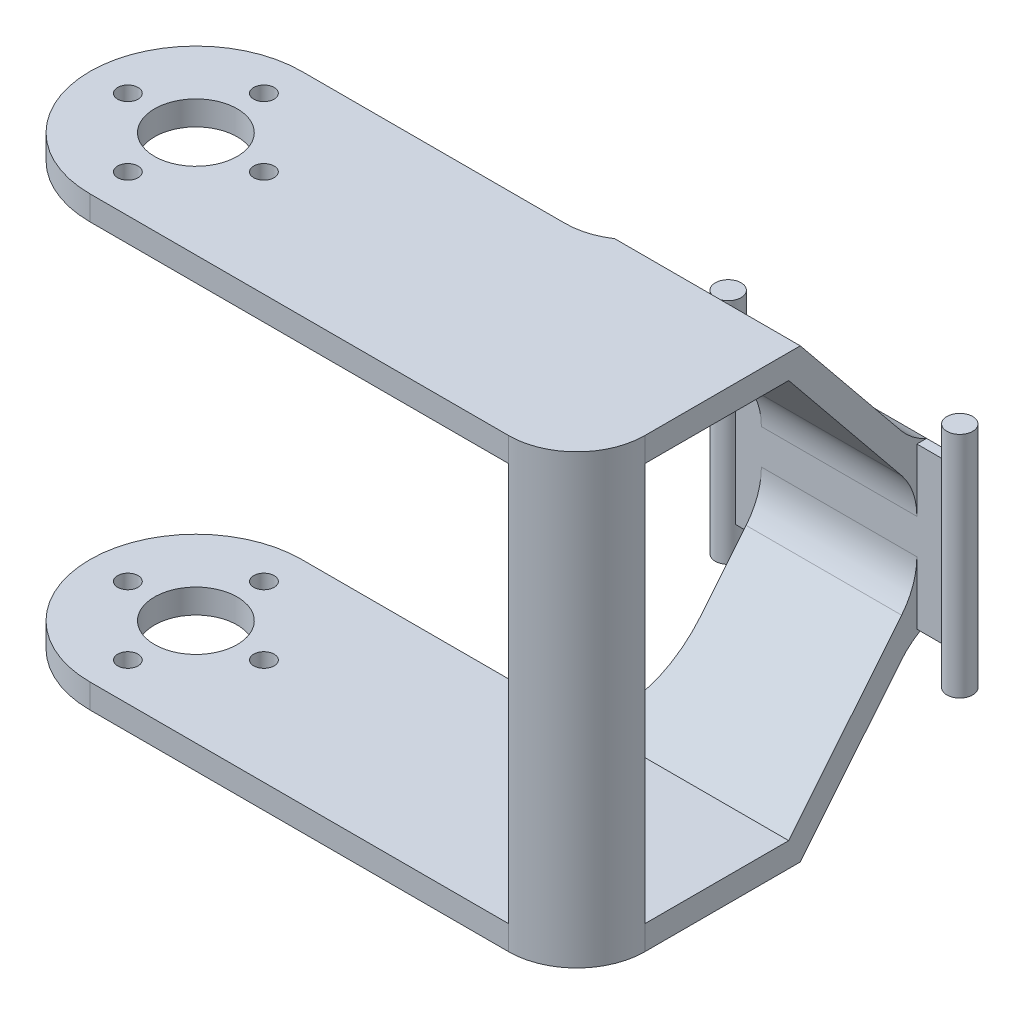
from build123d import *

# Parameters (mm, degrees)
SKETCH1_W           = 23.83
SKETCH1_H           = 1
BOSS_EXTRUDE1_DEPTH = 16.5
SKETCH2_R           = 1.325
BOSS_EXTRUDE2_DEPTH = 11.75
BOSS_EXTRUDE4_DEPTH = 8
SKETCH5_W           = 21.811051378
SKETCH5_H           = 2.5
BOSS_EXTRUDE5_DEPTH = 45
SKETCH6_R           = 4.25
SKETCH6_R_2         = 1.05
CUT_EXTRUDE1_DEPTH  = 79.646360374
FILLET1_R           = 7
FILLET2_R           = 7
FILLET3_R           = 7
BOSS_EXTRUDE6_START = 41
BOSS_EXTRUDE6_DEPTH = 41


with BuildPart() as part:
    # Sketch1 → Boss-Extrude1 (new body)
    with BuildSketch(Plane(origin=(0, 0, 0), x_dir=(1, 0, 0), z_dir=(0, 1, 0))):
        Rectangle(SKETCH1_W, SKETCH1_H)
    extrude(amount=BOSS_EXTRUDE1_DEPTH)

    # Sketch2 → Boss-Extrude2 (add, symmetric)
    with BuildSketch(Plane(origin=(0, 8.25, 0), x_dir=(1, 0, 0), z_dir=(0, 1, 0))):
        with Locations(Location((-11.915, 0, 0), (0, 0, 270))):
            Circle(SKETCH2_R)
        with Locations(Location((11.915, 0, 0), (0, 0, 270))):
            Circle(SKETCH2_R)
    extrude(amount=BOSS_EXTRUDE2_DEPTH, both=True)

    # Sketch4 → Boss-Extrude4 (add, symmetric)
    with BuildSketch(Plane(origin=(0, 0, 0), x_dir=(0, 0, -1), z_dir=(1, 0, 0))):
        Polygon((-0.5, 12.538583985), (-0.5, 16.5), (-12.5, 31.25), (-35.5, 31.25), (-35.5, 28.75), (-13.688948622, 28.75), align=None)
        Polygon((-0.5, 0), (-0.5, 3.961416015), (-13.688948622, -12.25), (-35.5, -12.25), (-35.5, -14.75), (-12.5, -14.75), align=None)
    extrude(amount=BOSS_EXTRUDE4_DEPTH, both=True)

    # Sketch5 → Boss-Extrude5 (add)
    with BuildSketch(Plane.ZY.offset(8)):
        with Locations((24.594474311, 30)):
            Rectangle(SKETCH5_W, SKETCH5_H)
        with Locations((24.594474311, -13.5)):
            Rectangle(SKETCH5_W, SKETCH5_H)
    extrude(amount=BOSS_EXTRUDE5_DEPTH)

    # Sketch6 → Cut-Extrude1 (cut, through all)
    with BuildSketch(Plane(origin=(0, 31.25, 0), x_dir=(1, 0, 0), z_dir=(0, 1, 0))):
        with Locations(Location((-42.094474311, -24.594474311, 0), (0, 0, 270))):
            Circle(SKETCH6_R)
        with Locations(Location((-49.094474311, -24.594474311, 0), (0, 0, 270))):
            Circle(SKETCH6_R_2)
        with Locations(Location((-42.094474311, -17.594474311, 0), (0, 0, 270))):
            Circle(SKETCH6_R_2)
        with Locations(Location((-35.094474311, -24.594474311, 0), (0, 0, 270))):
            Circle(SKETCH6_R_2)
        with Locations(Location((-42.094474311, -31.594474311, 0), (0, 0, 270))):
            Circle(SKETCH6_R_2)
        with BuildLine():
            ThreePointArc((-53, -24.594474311), (-49.805845478, -16.883103144), (-42.094474311, -13.688948622))
            Line((-42.094474311, -13.688948622), (-53, -13.688948622))
            Line((-53, -13.688948622), (-53, -24.594474311))
        make_face()
        with BuildLine():
            ThreePointArc((-42.094474311, -35.5), (-49.805845478, -32.305845478), (-53, -24.594474311))
            Line((-53, -24.594474311), (-53, -35.5))
            Line((-53, -35.5), (-42.094474311, -35.5))
        make_face()
    extrude(amount=-CUT_EXTRUDE1_DEPTH, mode=Mode.SUBTRACT)

    # Fillet1
    # the kernel refuses this fillet: 7 mm, written as the material it adds along each edge
    with BuildSketch(Plane(origin=(-8, -14.75, 13.688948622), x_dir=(-1, 0, 0), z_dir=(0, 1, 0))) as fillet1_piece_1_section:
        with BuildLine():
            CenterArc((FILLET1_R, -FILLET1_R), FILLET1_R, 90, 90)
            Line((0, -FILLET1_R), (0, 0))
            Line((0, 0), (FILLET1_R, 0))
        make_face()
    fillet1_piece_1 = extrude(amount=2.5, mode=Mode.PRIVATE)
    fillet1_piece_1 = split(fillet1_piece_1, bisect_by=Plane(origin=(-10.031790315, -14.125351158, 11.991811112), z_dir=(0, 0.6310874674162202, 0.7757116786991036)), keep=Keep.TOP, mode=Mode.PRIVATE)
    fillet1_piece_1 = split(fillet1_piece_1, bisect_by=Plane(origin=(-10.031790315, -12.54763249, 13.931090308), z_dir=(0, -0.6310874674162201, -0.7757116786991036)), keep=Keep.TOP, mode=Mode.PRIVATE)
    add(fillet1_piece_1)
    with BuildSketch(Plane(origin=(-8, -14.75, 13.688948622), x_dir=(-1, 0, 0), z_dir=(0, 1, 0))) as fillet1_piece_2_section:
        with BuildLine():
            CenterArc((FILLET1_R, -FILLET1_R), FILLET1_R, 90, 90)
            Line((0, -FILLET1_R), (0, 0))
            Line((0, 0), (FILLET1_R, 0))
        make_face()
    fillet1_piece_2 = extrude(amount=20, mode=Mode.PRIVATE)
    fillet1_piece_2 = split(fillet1_piece_2, bisect_by=Plane(origin=(-8.829123945, -11.325395044, 9.713880714), z_dir=(0, 0.6310874674162202, 0.7757116786991036)), keep=Keep.TOP, mode=Mode.PRIVATE)
    fillet1_piece_2 = split(fillet1_piece_2, bisect_by=Plane(origin=(-8.829123945, -12.25, 10.954048459), z_dir=(0, 1, 0)), keep=Keep.TOP, mode=Mode.PRIVATE)
    fillet1_piece_2 = split(fillet1_piece_2, bisect_by=Plane(origin=(-8.829123945, -9.747676376, 11.653159911), z_dir=(0, -0.6310874674162201, -0.7757116786991036)), keep=Keep.TOP, mode=Mode.PRIVATE)
    add(fillet1_piece_2)
    with BuildSketch(Plane(origin=(-8, 31.25, 13.688948622), x_dir=(0, 0, -1), z_dir=(0, -1, 0))) as fillet1_piece_3_section:
        with BuildLine():
            CenterArc((FILLET1_R, -FILLET1_R), FILLET1_R, 90, 90)
            Line((0, -FILLET1_R), (0, 0))
            Line((0, 0), (FILLET1_R, 0))
        make_face()
    fillet1_piece_3 = extrude(amount=2.5, mode=Mode.PRIVATE)
    fillet1_piece_3 = split(fillet1_piece_3, bisect_by=Plane(origin=(-10.031790315, 29.047632489, 13.931090308), z_dir=(0, 0.6310874674162203, -0.7757116786991034)), keep=Keep.TOP, mode=Mode.PRIVATE)
    fillet1_piece_3 = split(fillet1_piece_3, bisect_by=Plane(origin=(-10.031790315, 30.625351158, 11.991811112), z_dir=(0, -0.6310874674162202, 0.7757116786991036)), keep=Keep.TOP, mode=Mode.PRIVATE)
    add(fillet1_piece_3)
    with BuildSketch(Plane(origin=(-8, 31.25, 13.688948622), x_dir=(0, 0, -1), z_dir=(0, -1, 0))) as fillet1_piece_4_section:
        with BuildLine():
            CenterArc((FILLET1_R, -FILLET1_R), FILLET1_R, 90, 90)
            Line((0, -FILLET1_R), (0, 0))
            Line((0, 0), (FILLET1_R, 0))
        make_face()
    fillet1_piece_4 = extrude(amount=20, mode=Mode.PRIVATE)
    fillet1_piece_4 = split(fillet1_piece_4, bisect_by=Plane(origin=(-8.829123957, 26.247676381, 11.653159915), z_dir=(0, 0.6310874674162203, -0.7757116786991034)), keep=Keep.TOP, mode=Mode.PRIVATE)
    fillet1_piece_4 = split(fillet1_piece_4, bisect_by=Plane(origin=(-8.829123957, 27.82539505, 9.713880718), z_dir=(0, -0.6310874674162202, 0.7757116786991036)), keep=Keep.TOP, mode=Mode.PRIVATE)
    fillet1_piece_4 = split(fillet1_piece_4, bisect_by=Plane(origin=(-8.829123957, 28.75, 10.954048463), z_dir=(0, -1, 0)), keep=Keep.TOP, mode=Mode.PRIVATE)
    add(fillet1_piece_4)
    # the kernel refuses this fillet: 7 mm, written as the material it takes off along each edge
    with BuildSketch(Plane(origin=(8, 5.25, 35.5), x_dir=(0, 0, -1), z_dir=(0, -1, 0))) as fillet1_2_piece_1:
        with BuildLine():
            CenterArc((FILLET1_R, -FILLET1_R), FILLET1_R, 90, 90)
            Line((0, -FILLET1_R), (0, 0))
            Line((0, 0), (FILLET1_R, 0))
        make_face()
    extrude(amount=37.5, mode=Mode.SUBTRACT)
    with BuildSketch(Plane(origin=(8, 48.75, 35.5), x_dir=(-1, 0, 0), z_dir=(0, -1, 0))) as fillet1_2_piece_2:
        with BuildLine():
            CenterArc((FILLET1_R, FILLET1_R), FILLET1_R, 180, 90)
            Line((0, FILLET1_R), (0, 0))
            Line((0, 0), (FILLET1_R, 0))
        make_face()
    extrude(amount=37.5, mode=Mode.SUBTRACT)

    # Fillet2
    fillet2_edges = [part.edges().sort_by_distance(p)[0] for p in [
        (0, 12.538583985, 0.5),
        (0, 3.961416015, 0.5),
    ]]
    fillet(fillet2_edges, radius=FILLET2_R)

    # Fillet3
    # the kernel refuses this fillet: 7 mm, written as the material it adds along each edge
    with BuildSketch(Plane(origin=(-8, 16.5, 0.5), x_dir=(0, 0.7757116786988805, 0.6310874674164945), z_dir=(1, 0, 0))) as fillet3_piece_1:
        with BuildLine():
            CenterArc((2.571760467, -7), FILLET3_R, 90, 27.229107119)
            Line((-0.631087467, -0.775711679), (0, 0))
            Line((0, 0), (2.571760467, 0))
        make_face()
    extrude(amount=16)
    with BuildSketch(Plane(origin=(8, 0, 0.5), x_dir=(0, 0, -1), z_dir=(-1, 0, 0))) as fillet3_piece_2:
        with BuildLine():
            CenterArc((3.806975951, 6.412556901), FILLET3_R, 219.130399557, 27.229107119)
            Line((-1.6230058, 1.994944629), (0, 0))
            Line((0, 0), (1, 0))
        make_face()
    extrude(amount=16)

    # Sketch8 → Boss-Extrude6 (add)
    with BuildSketch(Plane(origin=(0, -12.25, 0), x_dir=(1, 0, 0), z_dir=(0, 1, 0)).offset(BOSS_EXTRUDE6_START)):
        with BuildLine():
            ThreePointArc((1, -35.5), (5.949747468, -33.449747468), (8, -28.5))
            Line((8, -28.5), (5, -28.5))
            ThreePointArc((5, -28.5), (3.422054899, -30.922054899), (1, -32.5))
            Line((1, -32.5), (1, -35.5))
        make_face()
    extrude(amount=-BOSS_EXTRUDE6_DEPTH)


solid = part.part
